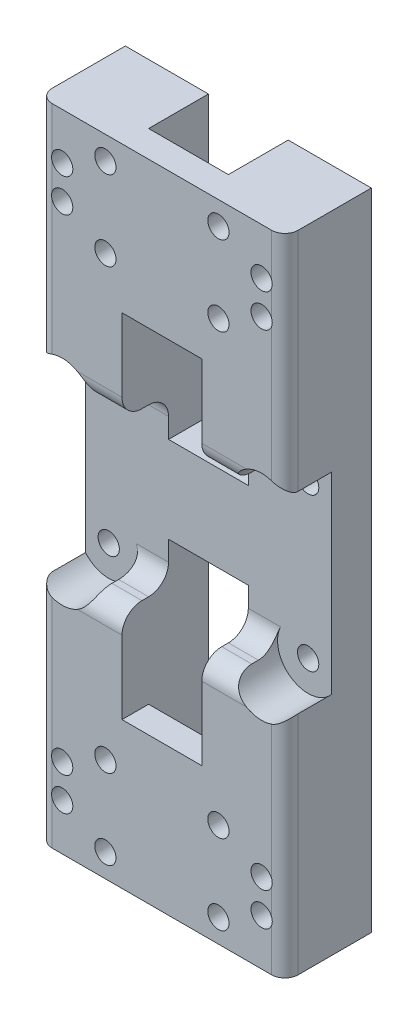
from build123d import *

# Parameters (mm, degrees)
SKETCH1_W             = 5
SKETCH1_H             = 22
BOSS_EXTRUDE1_DEPTH   = 9
BOSS_EXTRUDE1_2_DEPTH = 9
SKETCH2_W             = 22
SKETCH2_H             = 22
BOSS_EXTRUDE2_DEPTH   = 4
SKETCH3_R             = 1.6
CUT_EXTRUDE1_DEPTH    = 21.273134933
SKETCH4_W             = 1.5
SKETCH4_H             = 22
BOSS_EXTRUDE3_DEPTH   = 13
SKETCH5_W             = 6
SKETCH5_H             = 22
BOSS_EXTRUDE4_DEPTH   = 13
SKETCH6_R             = 1.6
CUT_EXTRUDE2_DEPTH    = 21
SKETCH7_W             = 12.5
SKETCH7_H             = 26.5
BOSS_EXTRUDE5_DEPTH   = 13
SKETCH8_W             = 46.962084772
SKETCH8_H             = 37
CUT_EXTRUDE3_DEPTH    = 7
SKETCH10_R            = 1.6
CUT_EXTRUDE4_DEPTH    = 6
SKETCH11_W            = 12.5
SKETCH11_H            = 14
BOSS_EXTRUDE6_DEPTH   = 7
FILLET3_R             = 3
SKETCH13_R            = 4.6
CUT_EXTRUDE5_DEPTH    = 13
FILLET4_R             = 3
SKETCH14_W            = 12
SKETCH14_H            = 13
BOSS_EXTRUDE8_DEPTH   = 6
FILLET5_R             = 2


with BuildPart() as part:
    # Sketch1 → Boss-Extrude1 (new body)
    with BuildSketch(Plane.XY):
        with Locations((8.5, 0)):
            Rectangle(SKETCH1_W, SKETCH1_H)
    extrude(amount=BOSS_EXTRUDE1_DEPTH)



with BuildPart() as body_2:
    # Sketch1 → Boss-Extrude1 2 (new body)
    with BuildSketch(Plane.XY):
        with Locations((-8.5, 0)):
            Rectangle(SKETCH1_W, SKETCH1_H)
    extrude(amount=BOSS_EXTRUDE1_2_DEPTH)


with BuildPart() as part_1:
    add(part.part)

    add(body_2.part)  # Boss-Extrude2 merges body 2
    # Sketch2 → Boss-Extrude2 (add)
    with BuildSketch(Plane.XY.offset(9)):
        Rectangle(SKETCH2_W, SKETCH2_H)
    extrude(amount=BOSS_EXTRUDE2_DEPTH)

    # Sketch3 → Cut-Extrude1 (cut, through all)
    with BuildSketch(Plane(origin=(0, 0, 0), x_dir=(-1, 0, 0), z_dir=(0, 0, -1))):
        with Locations((8.5, 4.5)):
            Circle(SKETCH3_R)
        with Locations((8.5, -7.5)):
            Circle(SKETCH3_R)
        with Locations((-8.5, 4.5)):
            Circle(SKETCH3_R)
        with Locations((-8.5, -7.5)):
            Circle(SKETCH3_R)
    extrude(amount=-CUT_EXTRUDE1_DEPTH, mode=Mode.SUBTRACT)

    # Sketch4 → Boss-Extrude3 (add)
    with BuildSketch(Plane.XY.offset(13)):
        with Locations((11.75, 0)):
            Rectangle(SKETCH4_W, SKETCH4_H)
        with Locations((-11.75, 0)):
            Rectangle(SKETCH4_W, SKETCH4_H)
    extrude(amount=-BOSS_EXTRUDE3_DEPTH)

    # Sketch5 → Boss-Extrude4 (add)
    with BuildSketch(Plane.XY.offset(13)):
        with Locations((-15.5, 0)):
            Rectangle(SKETCH5_W, SKETCH5_H)
        with Locations((15.5, 0)):
            Rectangle(SKETCH5_W, SKETCH5_H)
    extrude(amount=-BOSS_EXTRUDE4_DEPTH)

    # Sketch6 → Cut-Extrude2 (cut)
    with BuildSketch(Plane(origin=(0, 0, 0), x_dir=(-1, 0, 0), z_dir=(0, 0, -1))):
        with Locations((15, 1)):
            Circle(SKETCH6_R)
        with Locations((15, -4)):
            Circle(SKETCH6_R)
        with Locations(Location((-15, -4, 0), (0, 0, 180))):
            Circle(SKETCH6_R)
        with Locations(Location((-15, 1, 0), (0, 0, 180))):
            Circle(SKETCH6_R)
    extrude(amount=-CUT_EXTRUDE2_DEPTH, mode=Mode.SUBTRACT)

    # Sketch7 → Boss-Extrude5 (add)
    with BuildSketch(Plane.XY.offset(13)):
        with Locations((12.25, 24.25)):
            Rectangle(SKETCH7_W, SKETCH7_H)
        with Locations((-12.25, 24.25)):
            Rectangle(SKETCH7_W, SKETCH7_H)
    extrude(amount=-BOSS_EXTRUDE5_DEPTH)

    # Mirror1: part across plane


with BuildPart() as part_2:
    add(part_1.part)
    add(part_1.part.mirror(Plane(origin=(-18.5, 37.5, -29.300170648), x_dir=(0, 0, 1), z_dir=(0, 1, 0))))

    # Sketch8 → Cut-Extrude3 (cut)
    with BuildSketch(Plane.XY.offset(13)):
        with Locations((1.158459791, 37.5)):
            Rectangle(SKETCH8_W, SKETCH8_H)
    extrude(amount=-CUT_EXTRUDE3_DEPTH, mode=Mode.SUBTRACT)

    # Sketch10 → Cut-Extrude4 (cut)
    with BuildSketch(Plane.XY.offset(6)):
        with Locations((-15, 26)):
            Circle(SKETCH10_R)
        with Locations((15, 26)):
            Circle(SKETCH10_R)
        with Locations(Location((15, 49, 0), (0, 0, 180))):
            Circle(SKETCH10_R)
        with Locations(Location((-15, 49, 0), (0, 0, 180))):
            Circle(SKETCH10_R)
    extrude(amount=-CUT_EXTRUDE4_DEPTH, mode=Mode.SUBTRACT)

    # Sketch11 → Boss-Extrude6 (add)
    with BuildSketch(Plane.XY.offset(13)):
        with Locations((-12.25, 18)):
            Rectangle(SKETCH11_W, SKETCH11_H)
        with Locations((12.25, 18)):
            Rectangle(SKETCH11_W, SKETCH11_H)
        with Locations((12.25, 57)):
            Rectangle(SKETCH11_W, SKETCH11_H)
        with Locations((-12.25, 57)):
            Rectangle(SKETCH11_W, SKETCH11_H)
    extrude(amount=-BOSS_EXTRUDE6_DEPTH)

    # Fillet3
    # the kernel refuses this fillet: 3 mm, written as the material it takes off along each edge
    with BuildSketch(Plane(origin=(23.7489996, 25, 6), x_dir=(0, 0, 1), z_dir=(-1, 0, 0))) as fillet3_piece_1_section:
        with BuildLine():
            CenterArc((FILLET3_R, -FILLET3_R), FILLET3_R, 90, 90)
            Line((0, -FILLET3_R), (0, 0))
            Line((0, 0), (FILLET3_R, 0))
        make_face()
    fillet3_piece_1 = extrude(amount=17.497999199, mode=Mode.PRIVATE)
    fillet3_piece_1 = fillet3_piece_1 & Plane(origin=(15, 26, 6.994713579), x_dir=(1, 0, 0), z_dir=(0, 0, 1)) * Cylinder(1.6, 47, mode=Mode.PRIVATE)
    add(fillet3_piece_1, mode=Mode.SUBTRACT)
    with BuildSketch(Plane(origin=(-23.7489996, 25, 6), x_dir=(0, -1, 0), z_dir=(1, 0, 0))) as fillet3_piece_2_section:
        with BuildLine():
            CenterArc((FILLET3_R, -FILLET3_R), FILLET3_R, 90, 90)
            Line((0, -FILLET3_R), (0, 0))
            Line((0, 0), (FILLET3_R, 0))
        make_face()
    fillet3_piece_2 = extrude(amount=17.497999199, mode=Mode.PRIVATE)
    fillet3_piece_2 = fillet3_piece_2 & Plane(origin=(-15, 26, 6.994713968), x_dir=(1, 0, 0), z_dir=(0, 0, 1)) * Cylinder(1.6, 47, mode=Mode.PRIVATE)
    add(fillet3_piece_2, mode=Mode.SUBTRACT)

    # Sketch13 → Cut-Extrude5 (cut)
    with BuildSketch(Plane.XY.offset(19)):
        with Locations((-15, 26)):
            Circle(SKETCH13_R)
        with Locations((15, 26)):
            Circle(SKETCH13_R)
        with Locations((15, 49)):
            Circle(SKETCH13_R)
        with Locations((-15, 49)):
            Circle(SKETCH13_R)
    extrude(amount=-CUT_EXTRUDE5_DEPTH, mode=Mode.SUBTRACT)

    # Fillet4
    fillet4_edges = [part_2.edges().sort_by_distance(p)[0] for p in [
        (-8.255005568, 25, 13),
        (-8.255005568, 25, 6),
        (8.255005568, 50, 13),
        (8.255005568, 50, 6),
        (-8.255005568, 50, 6),
        (-8.255005568, 50, 13),
        (8.255005568, 25, 6),
        (8.255005568, 25, 13),
    ]]
    fillet(fillet4_edges, radius=FILLET4_R)

    # Sketch14 → Boss-Extrude8 (add)
    with BuildSketch(Plane.XY.offset(6)):
        with Locations((0, 37.5)):
            Rectangle(SKETCH14_W, SKETCH14_H)
    extrude(amount=-BOSS_EXTRUDE8_DEPTH)

    # Fillet5
    # the kernel refuses this fillet: 2 mm, written as the material it takes off along each edge
    with BuildSketch(Plane(origin=(18.5, 91, 13), x_dir=(-1, 0, 0), z_dir=(0, -1, 0)), Plane(origin=(-18.5, 46.984962311, 13), x_dir=(1, 0, 0), z_dir=(0, 1, 0)), Plane(origin=(18.5, -16, 13), x_dir=(0, 0, -1), z_dir=(0, 1, 0))) as fillet5_piece_1:
        with BuildLine():
            CenterArc((FILLET5_R, FILLET5_R), FILLET5_R, 180, 90)
            Line((0, FILLET5_R), (0, 0))
            Line((0, 0), (FILLET5_R, 0))
        make_face()
    extrude(amount=44.015037689, mode=Mode.SUBTRACT)
    with BuildSketch(Plane(origin=(-18.5, -16, 13), x_dir=(0, 0, -1), z_dir=(0, 1, 0))) as fillet5_piece_2:
        with BuildLine():
            CenterArc((FILLET5_R, -FILLET5_R), FILLET5_R, 90, 90)
            Line((0, -FILLET5_R), (0, 0))
            Line((0, 0), (FILLET5_R, 0))
        make_face()
    extrude(amount=44.015037689, mode=Mode.SUBTRACT)


solid = part_2.part
